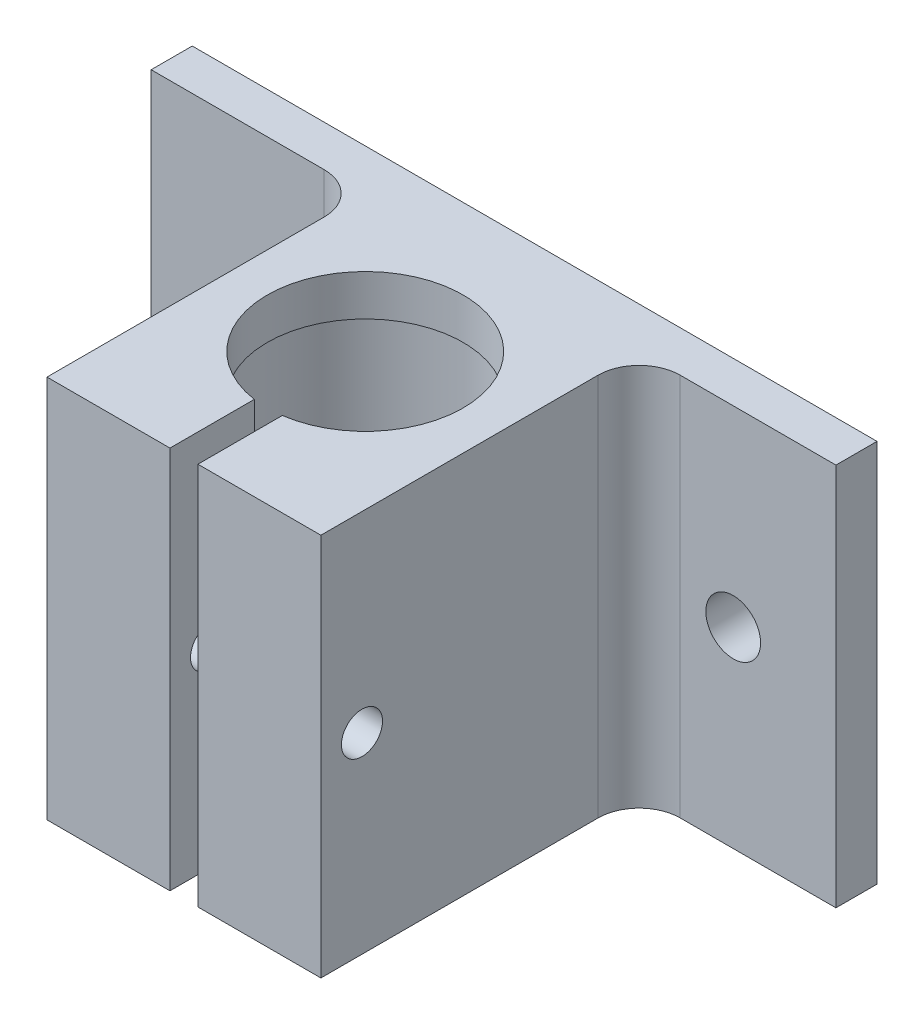
from build123d import *

# Parameters (mm, degrees)
BOSS_EXTRUDE1_DEPTH = 28
SKETCH2_R           = 1.5
CUT_EXTRUDE1_DEPTH  = 20
CUT_EXTRUDE2_DEPTH  = 2
SKETCH4_R           = 2
CUT_EXTRUDE3_DEPTH  = 3
FILLET1_R           = 3
FILLET2_R           = 3
SKETCH5_R           = 7.75
CUT_EXTRUDE4_DEPTH  = 25


with BuildPart() as part:
    # Sketch1 → Boss-Extrude1 (new body)
    with BuildSketch(Plane(origin=(0, 0, 0), x_dir=(1, 0, 0), z_dir=(0, 1, 0))):
        with BuildLine():
            Line((-25.631117397, 10), (-10, 10))
            Line((-10, 10), (-10, -13.238049007))
            Line((-10, -13.238049007), (-1.021428571, -13.238049007))
            Line((-1.021428571, -13.238049007), (-1.021428571, -7.076664728))
            ThreePointArc((-1.021428571, -7.076664728), (0, 7.15), (1.021428571, -7.076664728))
            Line((1.021428571, -7.076664728), (1.021428571, -13.238049007))
            Line((1.021428571, -13.238049007), (10, -13.238049007))
            Line((10, -13.238049007), (10, 10))
            Line((10, 10), (24.368882603, 10))
            Line((24.368882603, 10), (24.368882603, 13))
            Line((24.368882603, 13), (-25.631117397, 13))
            Line((-25.631117397, 13), (-25.631117397, 10))
        make_face()
    extrude(amount=BOSS_EXTRUDE1_DEPTH)

    # Sketch2 → Cut-Extrude1 (cut)
    with BuildSketch(Plane.ZY.offset(10)):
        with Locations((10.238049007, 14)):
            Circle(SKETCH2_R)
    extrude(amount=-CUT_EXTRUDE1_DEPTH, mode=Mode.SUBTRACT)

    # Sketch3 → Cut-Extrude2 (cut)
    with BuildSketch(Plane.ZY.offset(10)):
        Polygon((10.238049007, 17.175426481), (7.488049007, 15.58771324), (7.488049007, 12.41228676), (10.238049007, 10.824573519), (12.988049007, 12.41228676), (12.988049007, 15.58771324), align=None)
    extrude(amount=-CUT_EXTRUDE2_DEPTH, mode=Mode.SUBTRACT)

    # Sketch4 → Cut-Extrude3 (cut)
    with BuildSketch(Plane(origin=(0, 0, -13), x_dir=(-1, 0, 0), z_dir=(0, 0, -1))):
        with Locations((-16.868882603, 14)):
            Circle(SKETCH4_R)
        with Locations((16.868882603, 14)):
            Circle(SKETCH4_R)
    extrude(amount=-CUT_EXTRUDE3_DEPTH, mode=Mode.SUBTRACT)

    # Fillet1
    fillet1_edges = [part.edges().sort_by_distance(p)[0] for p in [
        (10, 14, -10),
    ]]
    fillet(fillet1_edges, radius=FILLET1_R)

    # Fillet2
    fillet2_edges = [part.edges().sort_by_distance(p)[0] for p in [
        (-10, 14, -10),
    ]]
    fillet(fillet2_edges, radius=FILLET2_R)

    # Sketch5 → Cut-Extrude4 (cut)
    with BuildSketch(Plane.XZ):
        Circle(SKETCH5_R)
    extrude(amount=-CUT_EXTRUDE4_DEPTH, mode=Mode.SUBTRACT)


solid = part.part
